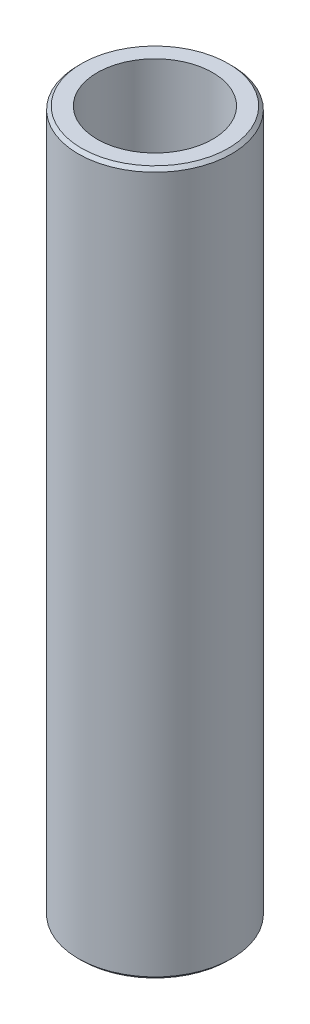
from build123d import *

# Parameters (mm, degrees)
SKETCH1_R           = 37.5
BOSS_EXTRUDE1_DEPTH = 344.070552029
SKETCH2_R           = 28.247100968
CUT_EXTRUDE1_DEPTH  = 349.133659352
CHAMFER1_SIZE       = 1.596190826


with BuildPart() as part:
    # Sketch1 → Boss-Extrude1 (new body)
    with BuildSketch(Plane(origin=(0, 0, 0), x_dir=(1, 0, 0), z_dir=(0, 1, 0))):
        Circle(SKETCH1_R)
    extrude(amount=BOSS_EXTRUDE1_DEPTH)

    # Sketch2 → Cut-Extrude1 (cut, through all)
    with BuildSketch(Plane(origin=(0, 0, 0), x_dir=(1, 0, 0), z_dir=(0, 1, 0))):
        Circle(SKETCH2_R)
    extrude(amount=CUT_EXTRUDE1_DEPTH, mode=Mode.SUBTRACT)

    # Chamfer1
    chamfer1_edges = [part.edges().sort_by_distance(p)[0] for p in [
        (-37.5, 344.070552029, 0),
        (-37.5, 0, 0),
    ]]
    chamfer(chamfer1_edges, length=CHAMFER1_SIZE)


solid = part.part
